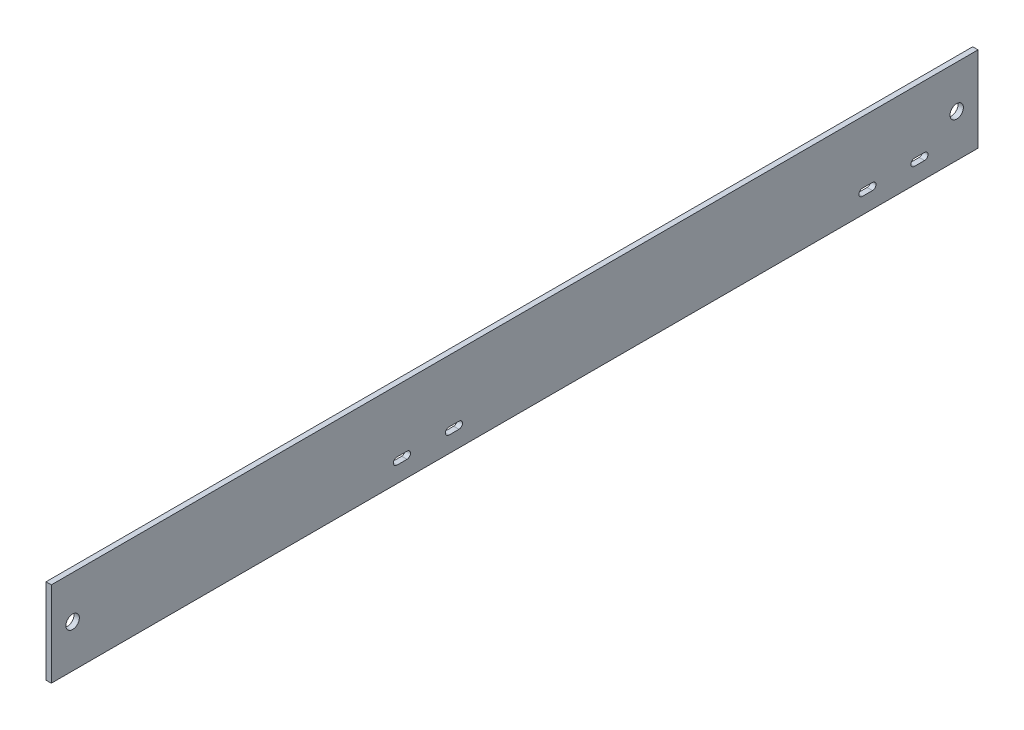
from build123d import *

# Parameters (mm, degrees)
SKETCH1_W           = 552.45
SKETCH1_H           = 50.8
SKETCH1_R           = 4
BOSS_EXTRUDE2_DEPTH = 3.175


with BuildPart() as part:
    # Sketch1 → Boss-Extrude2 (new body)
    with BuildSketch(Plane(origin=(0, 0, 0), x_dir=(0, 0, -1), z_dir=(1, 0, 0))):
        with Locations((276.225, 25.4)):
            Rectangle(SKETCH1_W, SKETCH1_H)
        with Locations((12.7, 25.4)):
            Circle(SKETCH1_R, mode=Mode.SUBTRACT)
        with Locations((539.75, 25.4)):
            Circle(SKETCH1_R, mode=Mode.SUBTRACT)
        with BuildLine():
            Line((206.025, 13.8), (212.025, 13.8))
            ThreePointArc((212.025, 13.8), (214.125, 11.7), (212.025, 9.6))
            Line((212.025, 9.6), (206.025, 9.6))
            ThreePointArc((206.025, 9.6), (203.925, 11.7), (206.025, 13.8))
        make_face(mode=Mode.SUBTRACT)
        with BuildLine():
            Line((237.025, 13.8), (243.025, 13.8))
            ThreePointArc((243.025, 13.8), (245.125, 11.7), (243.025, 9.6))
            Line((243.025, 9.6), (237.025, 9.6))
            ThreePointArc((237.025, 9.6), (234.925, 11.7), (237.025, 13.8))
        make_face(mode=Mode.SUBTRACT)
        with BuildLine():
            Line((483.55, 13.8), (489.55, 13.8))
            ThreePointArc((489.55, 13.8), (491.65, 11.7), (489.55, 9.6))
            Line((489.55, 9.6), (483.55, 9.6))
            ThreePointArc((483.55, 9.6), (481.45, 11.7), (483.55, 13.8))
        make_face(mode=Mode.SUBTRACT)
        with BuildLine():
            Line((514.55, 13.8), (520.55, 13.8))
            ThreePointArc((520.55, 13.8), (522.65, 11.7), (520.55, 9.6))
            Line((520.55, 9.6), (514.55, 9.6))
            ThreePointArc((514.55, 9.6), (512.45, 11.7), (514.55, 13.8))
        make_face(mode=Mode.SUBTRACT)
    extrude(amount=BOSS_EXTRUDE2_DEPTH)


solid = part.part
